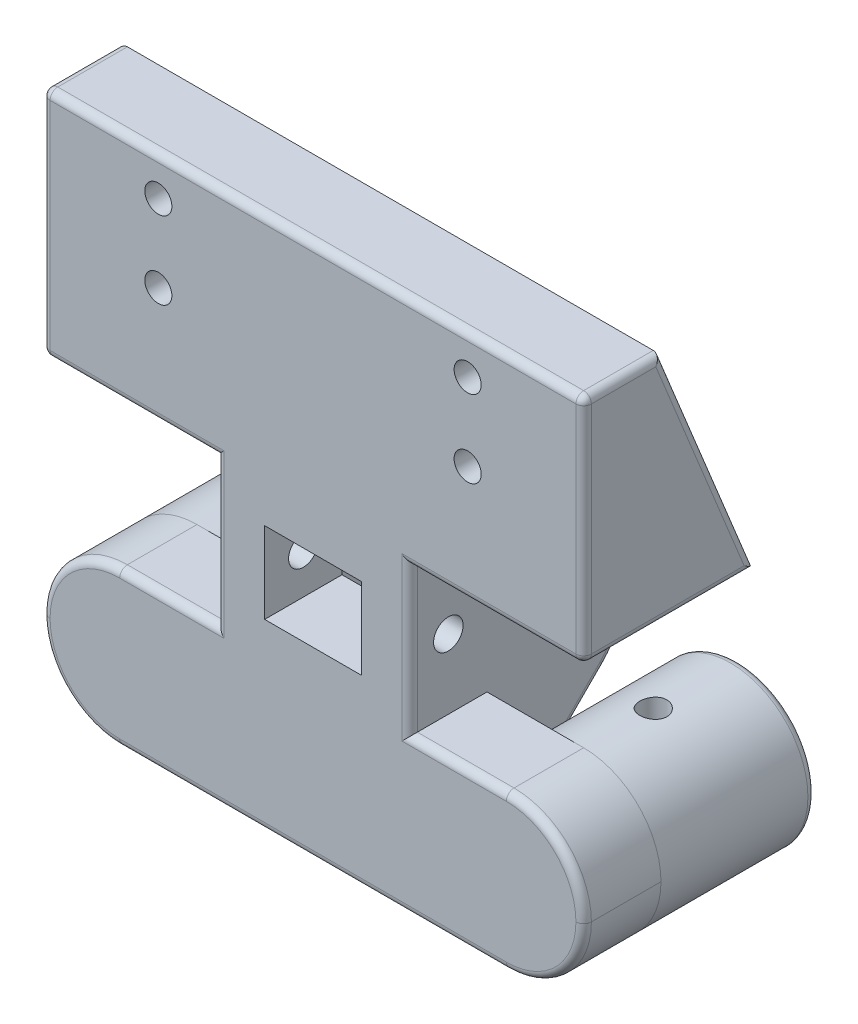
from build123d import *

# Parameters (mm, degrees)
SKETCH1_W               = 70
SKETCH1_H               = 20
BOSS_EXTRUDE1_DEPTH     = 10
SKETCH2_R               = 10
SKETCH2_R_2             = 6.3999999999999995
SKETCH2_R_3             = 10.000000000000002
SKETCH2_R_4             = 6.400000000000004
BOSS_EXTRUDE2_DEPTH     = 20
CUT_EXTRUDE1_DEPTH      = 42.53311931459038
CUT_EXTRUDE1_DEPTH_BACK = 42.53311931459038
SKETCH3_R               = 1.7499999999999998
BOSS_EXTRUDE3_DEPTH     = 10
CUT_EXTRUDE2_DEPTH      = 75.87322627615295
SKETCH7_R               = 1.9096491949566043
CUT_EXTRUDE3_DEPTH      = 79.3406025857601
BOSS_EXTRUDE4_DEPTH     = 10
BOSS_EXTRUDE5_DEPTH     = 5
BOSS_EXTRUDE10_REACH    = 73.456
SKETCH11_W              = 70
SKETCH11_H              = 5.0000000000000036
CUT_EXTRUDE4_REACH      = 73.456
SKETCH12_R              = 1.7500000000000004
BOSS_EXTRUDE11_DEPTH    = 5
FILLET1_R               = 10
FILLET2_R               = 10
FILLET6_R               = 1
FILLET7_R               = 1
FILLET9_R               = 1
FILLET15_R              = 1
FILLET16_R              = 1
FILLET17_R              = 1
FILLET19_R              = 1
FILLET20_R              = 1
FILLET21_R              = 1


# Some blends are built 0.0001 mm under size
with BuildPart() as part:
    # Sketch1 → Boss-Extrude1 (new body)
    with BuildSketch(Plane.XY):
        Rectangle(SKETCH1_W, SKETCH1_H)
    extrude(amount=BOSS_EXTRUDE1_DEPTH)

    # Sketch2 → Boss-Extrude2 (add)
    # profile 1 of 2: a face of its own
    with BuildSketch(Plane(origin=(0, 0, 0), x_dir=(-1, 0, 0), z_dir=(0, 0, -1))):
        with Locations(Location((-25, 0, 0), (0, 0, 180))):
            Circle(SKETCH2_R)
        with Locations((-25, 0)):
            Circle(SKETCH2_R_2, mode=Mode.SUBTRACT)
    # profile 2 of 2: a face of its own
    with BuildSketch(Plane(origin=(0, 0, 0), x_dir=(-1, 0, 0), z_dir=(0, 0, -1))):
        with Locations((25, 0)):
            Circle(SKETCH2_R_3)
        with Locations((25, 0)):
            Circle(SKETCH2_R_4, mode=Mode.SUBTRACT)
    extrude(amount=BOSS_EXTRUDE2_DEPTH)

    # Sketch3 → Cut-Extrude1 (cut, two sides: drawn at the far end of the back side and taken through both)
    with BuildSketch(Plane(origin=(0, 0, 0), x_dir=(1, 0, 0), z_dir=(0, 1, 0)).offset(-CUT_EXTRUDE1_DEPTH_BACK)):
        with Locations(Location((-25, 9, 0), (0, 0, 270))):
            Circle(SKETCH3_R)
        with Locations(Location((25, 9, 0), (0, 0, 270))):
            Circle(SKETCH3_R)
    extrude(amount=CUT_EXTRUDE1_DEPTH + CUT_EXTRUDE1_DEPTH_BACK, mode=Mode.SUBTRACT)

    # Sketch4 → Boss-Extrude3 (add)
    with BuildSketch(Plane.XY.offset(10)):
        Polygon((-12.500000000000004, 10), (12.500000000000004, 10), (12.499999999999996, 59.00000000000001), (-12.500000000000004, 59.00000000000001), align=None)
    extrude(amount=-BOSS_EXTRUDE3_DEPTH)

    # Sketch6 → Cut-Extrude2 (cut, through all)
    with BuildSketch(Plane.XY.offset(10)):
        Polygon((-6.25, 24.25), (6.25, 24.25), (6.250000000000002, 13.75), (-6.249999999999999, 13.75), align=None)
    extrude(amount=-CUT_EXTRUDE2_DEPTH, mode=Mode.SUBTRACT)

    # Sketch7 → Cut-Extrude3 (cut, through all)
    with BuildSketch(Plane.ZY.offset(12.500000000000004)):
        with Locations((5, 19)):
            Circle(SKETCH7_R)
    extrude(amount=-CUT_EXTRUDE3_DEPTH, mode=Mode.SUBTRACT)

    # Sketch8 → Boss-Extrude4 (add)
    with BuildSketch(Plane.XY.offset(10)):
        Polygon((35.000000000000014, 29.00000000000001), (-34.99999999999999, 29.000000000000004), (-34.99999999999999, 59.00000000000001), (35.000000000000014, 59.00000000000001), align=None)
    extrude(amount=-BOSS_EXTRUDE4_DEPTH)

    # Sketch9 → Boss-Extrude5 (add)
    with BuildSketch(Plane(origin=(12.500000000000005, 1.77e-15, 0), x_dir=(0, 0, -1), z_dir=(1, 9e-17, 0))):
        Polygon((0, -10.000000000000004), (0, 29.000000000000007), (12.24489795918367, 29.000000000000007), (20, 9.999999999999998), align=None)
    boss_extrude5 = extrude(amount=-BOSS_EXTRUDE5_DEPTH)

    # Mirror3: Boss-Extrude5 across plane
    add(boss_extrude5.mirror(Plane(origin=(0, 0, 0), x_dir=(0, 0, 1), z_dir=(1, 0, 0))))

    # Boss-Extrude10: up to this plane
    boss_extrude10_end = Plane(origin=(7.500000000000004, 10, -20), z_dir=(0, 0.37789699742661176, -0.9258476436951987))
    # Sketch11 → Boss-Extrude10 (add, up to the surface)
    with BuildSketch(Plane(origin=(0, 0, 0), x_dir=(-1, 0, 0), z_dir=(0, 0, -1)), mode=Mode.PRIVATE) as boss_extrude10_sk1:
        with Locations((-1.066e-14, 31.500000000000014)):
            Rectangle(SKETCH11_W, SKETCH11_H)
    boss_extrude10_tool1 = split(extrude(boss_extrude10_sk1.sketch, amount=BOSS_EXTRUDE10_REACH, mode=Mode.PRIVATE), bisect_by=boss_extrude10_end, keep=Keep.BOTH, mode=Mode.PRIVATE)
    add(boss_extrude10_tool1.solids().sort_by_distance((0, 31.5, 0))[0])

    # Sketch12 → Cut-Extrude4 (cut, up to next)
    with BuildSketch(Plane(origin=(0, 0, 0), x_dir=(-1, 0, 0), z_dir=(0, 0, -1)), mode=Mode.PRIVATE) as cut_extrude4_sk1:
        with Locations((-20.000000000000007, 54.00000000000001)):
            Circle(SKETCH12_R)
    cut_extrude4_tool1 = extrude(cut_extrude4_sk1.sketch, amount=-CUT_EXTRUDE4_REACH, mode=Mode.PRIVATE) & part.part
    # Sketch12 → Cut-Extrude4 (cut, up to next)
    with BuildSketch(Plane(origin=(0, 0, 0), x_dir=(-1, 0, 0), z_dir=(0, 0, -1)), mode=Mode.PRIVATE) as cut_extrude4_sk2:
        with Locations((19.999999999999996, 54.00000000000001)):
            Circle(SKETCH12_R)
    cut_extrude4_tool2 = extrude(cut_extrude4_sk2.sketch, amount=-CUT_EXTRUDE4_REACH, mode=Mode.PRIVATE) & part.part
    # Sketch12 → Cut-Extrude4 (cut, up to next)
    with BuildSketch(Plane(origin=(0, 0, 0), x_dir=(-1, 0, 0), z_dir=(0, 0, -1)), mode=Mode.PRIVATE) as cut_extrude4_sk3:
        with Locations((-20.000000000000007, 44.00000000000001)):
            Circle(SKETCH12_R)
    cut_extrude4_tool3 = extrude(cut_extrude4_sk3.sketch, amount=-CUT_EXTRUDE4_REACH, mode=Mode.PRIVATE) & part.part
    # Sketch12 → Cut-Extrude4 (cut, up to next)
    with BuildSketch(Plane(origin=(0, 0, 0), x_dir=(-1, 0, 0), z_dir=(0, 0, -1)), mode=Mode.PRIVATE) as cut_extrude4_sk4:
        with Locations((19.999999999999996, 44.00000000000001)):
            Circle(SKETCH12_R)
    cut_extrude4_tool4 = extrude(cut_extrude4_sk4.sketch, amount=-CUT_EXTRUDE4_REACH, mode=Mode.PRIVATE) & part.part
    add(cut_extrude4_tool1.solids().sort_by_distance((20, 54, 0))[0], mode=Mode.SUBTRACT)
    add(cut_extrude4_tool2.solids().sort_by_distance((-20, 54, 0))[0], mode=Mode.SUBTRACT)
    add(cut_extrude4_tool3.solids().sort_by_distance((20, 44, 0))[0], mode=Mode.SUBTRACT)
    add(cut_extrude4_tool4.solids().sort_by_distance((-20, 44, 0))[0], mode=Mode.SUBTRACT)

    # Sketch16 → Boss-Extrude11 (add)
    with BuildSketch(Plane(origin=(35.000000000000014, 0, 0), x_dir=(0, 0, -1), z_dir=(1, 0, 0))):
        Polygon((-10, 59.00000000000001), (0, 59.00000000000001), (12.244897959183668, 29.00000000000001), (-10, 29.000000000000007), align=None)
    boss_extrude11 = extrude(amount=-BOSS_EXTRUDE11_DEPTH)

    # Mirror4: Boss-Extrude11 across plane
    add(boss_extrude11.mirror(Plane(origin=(0, 0, 0), x_dir=(0, 0, 1), z_dir=(1, 0, 0))))

    # Fillet1
    fillet1_edges = [part.edges().sort_by_distance(p)[0] for p in [
        (-34.99999999999999, -10, 5),
        (-34.99999999999999, 10, 5),
        (35.00000000000001, 10, 5),
        (35.00000000000001, -10, 5),
    ]]
    fillet(fillet1_edges, radius=FILLET1_R - 0.0001)  # a hair under: the kernel refuses the full size

    # Fillet2
    fillet2_edges = [part.edges().sort_by_distance(p)[0] for p in [
        (10.000000000000005, 10, -20),
        (-10.000000000000005, 10, -20),
    ]]
    fillet(fillet2_edges, radius=FILLET2_R)

    # Fillet6
    fillet6_edges = [part.edges().sort_by_distance(p)[0] for p in [
        (30.000000000000014, 46.500000000000014, -5.102040816326528),
        (-1.78e-15, 34.000000000000014, -10.204081632653054),
        (-30.000000000000014, 46.500000000000014, -5.102040816326528),
    ]]
    fillet(fillet6_edges, radius=FILLET6_R)

    # Fillet7
    fillet7_edges = [part.edges().sort_by_distance(p)[0] for p in [
        (7.500000000000005, -2.3491578141439935, -7.650842185856007),
        (12.500000000000005, -2.349157814143993, -7.650842185856007),
        (-12.500000000000009, -2.3491578141439917, -7.650842185856009),
        (-7.500000000000005, -2.3491578141439913, -7.650842185856009),
        (12.500000000000004, 22.575861078921807, -14.866995477991098),
        (7.5000000000000036, 22.575861078921807, -14.866995477991098),
        (-7.5000000000000036, 22.57586107892181, -14.866995477991097),
        (-12.500000000000005, 22.575861078921807, -14.866995477991097),
        (-12.500000000000004, 10.396476351018356, -18.033388302248923),
        (-7.500000000000004, 10.396476351018356, -18.033388302248923),
        (12.500000000000004, 10.396476351018354, -18.033388302248923),
        (7.5000000000000036, 10.396476351018354, -18.033388302248923),
    ]]
    fillet(fillet7_edges, radius=FILLET7_R)

    # Fillet9
    fillet9_edges = [part.edges().sort_by_distance(p)[0] for p in [
        (0, 29.00000000000001, -12.244897959183664),
    ]]
    fillet(fillet9_edges, radius=FILLET9_R)

    # Fillet15
    fillet15_edges = [part.edges().sort_by_distance(p)[0] for p in [
        (-34.99999999999999, 59.00000000000001, 5),
        (-34.99999999999999, 44.00000000000001, 10),
        (-34.99999999999999, 29.000000000000007, -1.1224489795918338),
        (35.000000000000014, 59.00000000000001, 5),
        (35.000000000000014, 29.00000000000001, -1.1224489795918338),
        (35.000000000000014, 44.00000000000001, 10),
        (35.000000000000014, 44.00000000000001, -6.122448979591834),
        (-35, 44.00000000000001, -6.122448979591834),
    ]]
    fillet(fillet15_edges, radius=FILLET15_R)

    # Fillet16
    # the kernel refuses this fillet: 1 mm, written as the material it takes off along each edge
    with BuildSketch(Plane(origin=(-34, 30.000000000000004, 9), x_dir=(0, 0, 1), z_dir=(1e-16, -1, 0))) as fillet16_piece_1_section:
        Polygon((0, 0), (FILLET16_R, 0), (FILLET16_R, FILLET16_R), (0, FILLET16_R), align=None)
    fillet16_piece_1 = extrude(amount=FILLET16_R, mode=Mode.PRIVATE)
    fillet16_piece_1 = fillet16_piece_1 - Plane(origin=(-34, 30.000000000000004, 9), x_dir=(0.7071067811865475, 0, -0.7071067811865475), z_dir=(1e-16, -1, 0)) * Sphere(FILLET16_R, mode=Mode.PRIVATE)
    add(fillet16_piece_1, mode=Mode.SUBTRACT)
    with BuildSketch(Plane(origin=(34.000000000000014, 30.00000000000001, 9), x_dir=(0, 0, 1), z_dir=(1e-16, -1, 0))) as fillet16_piece_2_section:
        Polygon((0, 0), (FILLET16_R, 0), (FILLET16_R, -FILLET16_R), (0, -FILLET16_R), align=None)
    fillet16_piece_2 = extrude(amount=FILLET16_R, mode=Mode.PRIVATE)
    fillet16_piece_2 = fillet16_piece_2 - Plane(origin=(34.000000000000014, 30.00000000000001, 9), x_dir=(-0.7071067811865475, 0, -0.7071067811865475), z_dir=(1e-16, -1, 0)) * Sphere(FILLET16_R, mode=Mode.PRIVATE)
    add(fillet16_piece_2, mode=Mode.SUBTRACT)
    with BuildSketch(Plane(origin=(12.5, 29.000000000000007, 10), x_dir=(0, 0, -1), z_dir=(1, 1.6e-16, 0))) as fillet16_piece_3:
        with BuildLine():
            CenterArc((FILLET16_R, FILLET16_R), FILLET16_R, 180, 90)
            Line((0, FILLET16_R), (0, 0))
            Line((0, 0), (FILLET16_R, 0))
        make_face()
    extrude(amount=21.500000000000014, mode=Mode.SUBTRACT)
    with BuildSketch(Plane(origin=(-33.99999999999999, 29.000000000000004, 10), x_dir=(0, 0, -1), z_dir=(1, 1.6e-16, 0))) as fillet16_piece_4:
        with BuildLine():
            CenterArc((FILLET16_R, FILLET16_R), FILLET16_R, 180, 90)
            Line((0, FILLET16_R), (0, 0))
            Line((0, 0), (FILLET16_R, 0))
        make_face()
    extrude(amount=21.499999999999993, mode=Mode.SUBTRACT)

    # Fillet17
    # the kernel refuses this fillet: 1 mm, written as the material it takes off along each edge
    with BuildSketch(Plane(origin=(-33.99999999999999, 58.00000000000001, 9), x_dir=(0, 1, 0), z_dir=(0, 0, 1))) as fillet17_piece_1_section:
        Polygon((0, 0), (FILLET17_R, 0), (FILLET17_R, FILLET17_R), (0, FILLET17_R), align=None)
    fillet17_piece_1 = extrude(amount=FILLET17_R, mode=Mode.PRIVATE)
    fillet17_piece_1 = fillet17_piece_1 - Plane(origin=(-33.99999999999999, 58.00000000000001, 9), x_dir=(0.7071067811865475, -0.7071067811865475, 0), z_dir=(0, 0, 1)) * Sphere(FILLET17_R, mode=Mode.PRIVATE)
    add(fillet17_piece_1, mode=Mode.SUBTRACT)
    with BuildSketch(Plane(origin=(34.000000000000014, 58.00000000000001, 9), x_dir=(0, 1, 0), z_dir=(0, 0, 1))) as fillet17_piece_2_section:
        Polygon((0, 0), (FILLET17_R, 0), (FILLET17_R, -FILLET17_R), (0, -FILLET17_R), align=None)
    fillet17_piece_2 = extrude(amount=FILLET17_R, mode=Mode.PRIVATE)
    fillet17_piece_2 = fillet17_piece_2 - Plane(origin=(34.000000000000014, 58.00000000000001, 9), x_dir=(-0.7071067811865475, -0.7071067811865475, 0), z_dir=(0, 0, 1)) * Sphere(FILLET17_R, mode=Mode.PRIVATE)
    add(fillet17_piece_2, mode=Mode.SUBTRACT)
    with BuildSketch(Plane(origin=(34.000000000000014, 59.00000000000001, 10), x_dir=(0, -1, 0), z_dir=(-1, 0, 0))) as fillet17_piece_3:
        with BuildLine():
            CenterArc((FILLET17_R, -FILLET17_R), FILLET17_R, 90, 90)
            Line((0, -FILLET17_R), (0, 0))
            Line((0, 0), (FILLET17_R, 0))
        make_face()
    extrude(amount=68, mode=Mode.SUBTRACT)

    # Fillet19
    fillet19_edges = [part.edges().sort_by_distance(p)[0] for p in [
        (18.75005000000001, 10, 10),
        (32.07109710118737, -7.071097101187359, 10),
        (7.11e-15, -10, 10),
        (-32.071097101187355, -7.071097101187356, 10),
        (32.07109710118737, 7.07109710118736, 10),
        (-32.071097101187355, 7.07109710118736, 10),
        (-18.75005, 10, 10),
        (-12.500000000000002, 20, 10),
    ]]
    fillet(fillet19_edges, radius=FILLET19_R)

    # Fillet20
    fillet20_edges = [part.edges().sort_by_distance(p)[0] for p in [
        (12.500000000000002, 19.5, 10),
    ]]
    fillet(fillet20_edges, radius=FILLET20_R)

    # Fillet21
    fillet21_edges = [part.edges().sort_by_distance(p)[0] for p in [
        (15, -2.45e-15, -20),
        (-14.999999999999998, 1.22e-15, -20),
    ]]
    fillet(fillet21_edges, radius=FILLET21_R)


solid = part.part
